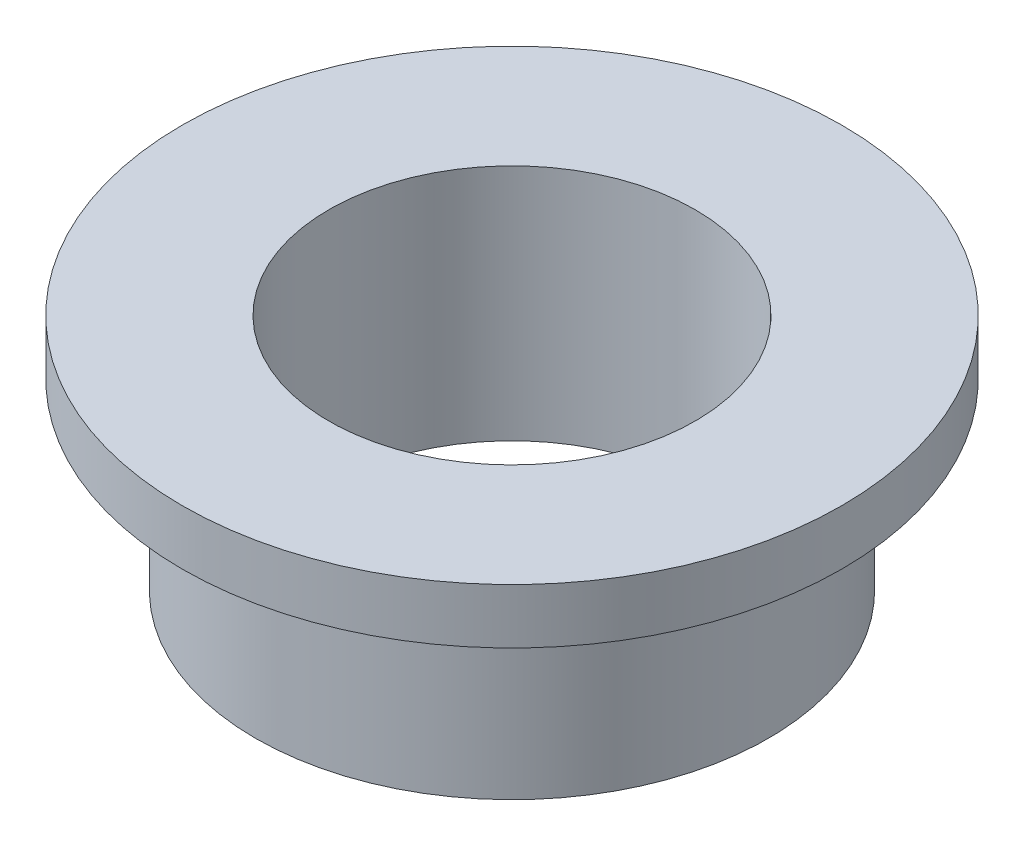
from build123d import *


with BuildPart() as part:
    # Sketch1 → Revolve1 (revolve)
    with BuildSketch(Plane.XY):
        Polygon((5, 0), (5, 6.5), (9, 6.5), (9, 5), (7, 5), (7, 0), align=None)
    revolve(axis=Axis((0, 0, 0), (0, 1, 0)))


solid = part.part
